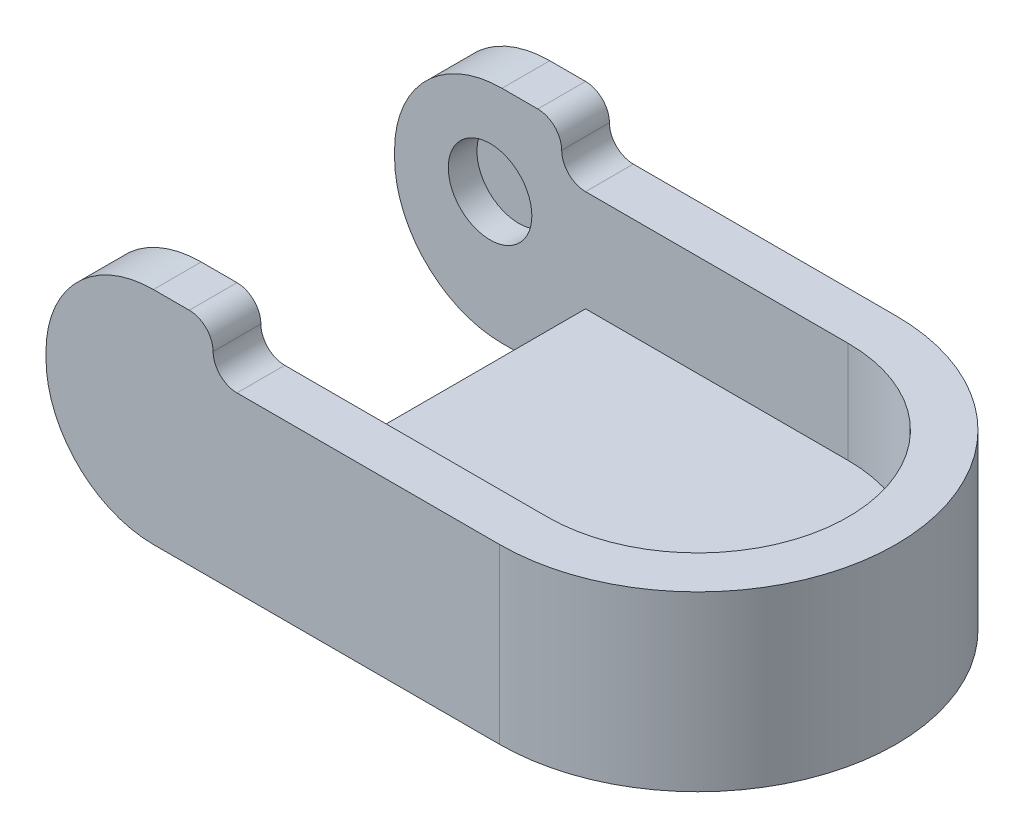
from build123d import *

# Parameters (mm, degrees)
BOSS_EXTRUDE1_DEPTH = 3
BOSS_EXTRUDE2_DEPTH = 4.25
CUT_EXTRUDE1_DEPTH  = 1.2
CUT_EXTRUDE2_START  = -1.2
CUT_EXTRUDE2_DEPTH  = 1.2
BOSS_EXTRUDE3_DEPTH = 2
BOSS_EXTRUDE4_DEPTH = 2
FILLET2_R           = 4.5
FILLET3_START       = -18
FILLET3_DEPTH       = 19
FILLET3_START_2     = -16.6
FILLET3_2_DEPTH     = 2
FILLET3_START_3     = -2
FILLET3_3_DEPTH     = 2
SKETCH7_W           = 5
SKETCH7_H           = 1.1
BOSS_EXTRUDE5_DEPTH = 0.7
FILLET4_R           = 0.5


with BuildPart() as part:
    # Sketch1 → Boss-Extrude1 (new body)
    with BuildSketch(Plane(origin=(0, 0, 0), x_dir=(1, 0, 0), z_dir=(0, 1, 0))):
        with BuildLine():
            Line((0, 0), (17, 0))
            ThreePointArc((17, 0), (25.3, 8.3), (17, 16.6))
            Line((17, 16.6), (0, 16.6))
            Line((0, 16.6), (0, 14.6))
            Line((0, 14.6), (6, 14.6))
            Line((6, 14.6), (6, 2))
            Line((6, 2), (0, 2))
            Line((0, 2), (0, 0))
        make_face()
    extrude(amount=BOSS_EXTRUDE1_DEPTH)

    # Sketch2 → Boss-Extrude2 (add)
    with BuildSketch(Plane(origin=(0, 3, 0), x_dir=(1, 0, 0), z_dir=(0, 1, 0))):
        with BuildLine():
            Line((6, 2), (0, 2))
            Line((0, 2), (0, 0))
            Line((0, 0), (17, 0))
            ThreePointArc((17, 0), (25.3, 8.3), (17, 16.6))
            Line((17, 16.6), (0, 16.6))
            Line((0, 16.6), (0, 14.6))
            Line((0, 14.6), (6, 14.6))
            Line((6, 14.6), (17, 14.6))
            ThreePointArc((17, 14.6), (23.3, 8.3), (17, 2))
            Line((17, 2), (6, 2))
        make_face()
    extrude(amount=BOSS_EXTRUDE2_DEPTH)

    # Sketch3 → Cut-Extrude1 (cut)
    with BuildSketch(Plane.XY.offset(-14.6)):
        with BuildLine():
            ThreePointArc((0.762563133, 6.487436867), (0.762563133, 4.012563133), (3.237436867, 4.012563133))
            Line((3.237436867, 4.012563133), (0.762563133, 6.487436867))
        make_face()
        with BuildLine():
            Line((0.762563133, 6.487436867), (3.237436867, 4.012563133))
            ThreePointArc((3.237436867, 4.012563133), (3.616789182, 4.580303993), (3.75, 5.25))
            ThreePointArc((3.75, 5.25), (2.669696007, 6.866789182), (0.762563133, 6.487436867))
        make_face()
    extrude(amount=-CUT_EXTRUDE1_DEPTH, mode=Mode.SUBTRACT)

    # Sketch4 → Cut-Extrude2 (cut)
    with BuildSketch(Plane(origin=(0, 0, -2), x_dir=(-1, 0, 0), z_dir=(0, 0, -1)).offset(CUT_EXTRUDE2_START)):
        with BuildLine():
            ThreePointArc((-0.25, 5.25), (-0.383210818, 5.919696007), (-0.762563133, 6.487436867))
            Line((-0.762563133, 6.487436867), (-3.237436867, 4.012563133))
            ThreePointArc((-3.237436867, 4.012563133), (-1.330303993, 3.633210818), (-0.25, 5.25))
        make_face()
        with BuildLine():
            Line((-3.237436867, 4.012563133), (-0.762563133, 6.487436867))
            ThreePointArc((-0.762563133, 6.487436867), (-3.237436867, 6.487436867), (-3.237436867, 4.012563133))
        make_face()
    extrude(amount=CUT_EXTRUDE2_DEPTH, mode=Mode.SUBTRACT)

    # Sketch5 → Boss-Extrude3 (add)
    with BuildSketch(Plane.XY):
        Polygon((5, 7.25), (5, 9.25), (-2, 9.25), (-2, 0), (0, 0), (0, 7.25), align=None)
    extrude(amount=-BOSS_EXTRUDE3_DEPTH)

    # Sketch6 → Boss-Extrude4 (add)
    with BuildSketch(Plane(origin=(0, 0, -16.6), x_dir=(-1, 0, 0), z_dir=(0, 0, -1))):
        Polygon((-5, 7.25), (-5, 9.25), (2, 9.25), (2, 0), (0, 0), (0, 7.25), align=None)
    extrude(amount=-BOSS_EXTRUDE4_DEPTH)

    # Fillet2
    fillet2_edges = [part.edges().sort_by_distance(p)[0] for p in [
        (-2, 0, -1),
        (-2, 9.25, -1),
        (-2, 9.25, -15.6),
        (-2, 0, -15.6),
    ]]
    fillet(fillet2_edges, radius=FILLET2_R)

    # Fillet3: read off the stored shape, not the designer's step
    # Fillet3 outline → Fillet3 (cut)
    with BuildSketch(Plane.XY.offset(FILLET3_START)):
        with BuildLine():
            Line((5, 9.25), (4, 9.25))
            ThreePointArc((4, 9.25), (4.707106781, 8.957106781), (5, 8.25))
            Line((5, 8.25), (5, 9.25))
        make_face()
    extrude(amount=FILLET3_DEPTH, mode=Mode.SUBTRACT)

    # Fillet3 2 outline → Fillet3 2 (add)
    with BuildSketch(Plane.XY.offset(FILLET3_START_2)):
        with BuildLine():
            ThreePointArc((6, 7.25), (5.292893219, 7.542893219), (5, 8.25))
            Line((5, 8.25), (5, 7.25))
            Line((5, 7.25), (6, 7.25))
        make_face()
    extrude(amount=FILLET3_2_DEPTH)

    # Fillet3 3 outline → Fillet3 3 (add)
    with BuildSketch(Plane.XY.offset(FILLET3_START_3)):
        with BuildLine():
            ThreePointArc((6, 7.25), (5.292893219, 7.542893219), (5, 8.25))
            Line((5, 8.25), (5, 7.25))
            Line((5, 7.25), (6, 7.25))
        make_face()
    extrude(amount=FILLET3_3_DEPTH)

    # Sketch7 → Boss-Extrude5 (add)
    with BuildSketch(Plane(origin=(23.5, 0, 0), x_dir=(0, 0, -1), z_dir=(1, 0, 0))):
        with Locations((8.3, 5.125)):
            Rectangle(SKETCH7_W, SKETCH7_H)
    extrude(amount=-BOSS_EXTRUDE5_DEPTH)

    # Fillet4
    fillet4_edges = [part.edges().sort_by_distance(p)[0] for p in [
        (22.8, 4.575, -8.3),
        (22.8, 5.675, -8.3),
    ]]
    fillet(fillet4_edges, radius=FILLET4_R - 0.0001)  # a hair under: the kernel refuses the full size


solid = part.part
